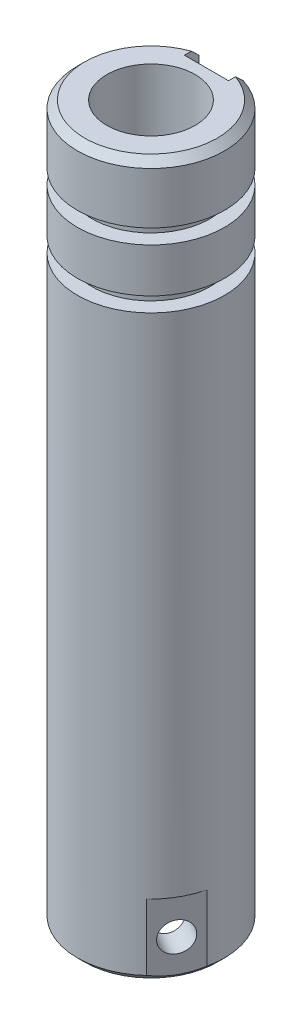
from build123d import *

# Parameters (mm, degrees)
ESQUISSE1_R                  = 5
ESQUISSE1_R_2                = 3
BOSS_EXTRU_1_DEPTH           = 48.5
ENL_V_MAT_EXTRU_1_DEPTH      = 5
ENL_V_MAT_EXTRU_2_REACH      = 51.901
ENL_V_MAT_EXTRU_2_END_RADIUS = 3
ESQUISSE3_R                  = 1
ESQUISSE4_R                  = 5
ESQUISSE4_R_2                = 4
ENL_V_MAT_EXTRU_3_DEPTH      = 1
ESQUISSE6_R                  = 5
ESQUISSE6_R_2                = 4
ENL_V_MAT_EXTRU_5_DEPTH      = 1
ENL_V_MAT_EXTRU_4_REACH      = 51.013


with BuildPart() as part:
    # Esquisse1 → Boss.-Extru.1 (new body)
    with BuildSketch(Plane(origin=(0, 0, 0), x_dir=(1, 0, 0), z_dir=(0, 1, 0))):
        with Locations(Location((0, 0, 0), (0, 0, 90))):
            Circle(ESQUISSE1_R)
        with Locations(Location((0, 0, 0), (0, 0, 90))):
            Circle(ESQUISSE1_R_2, mode=Mode.SUBTRACT)
    extrude(amount=BOSS_EXTRU_1_DEPTH)

    # Esquisse2 → Enlèv. mat.-Extru.1 (cut)
    with BuildSketch(Plane.XZ):
        with BuildLine():
            Line((-1.5, -4.769696007), (1.5, -4.769696007))
            ThreePointArc((1.5, -4.769696007), (0, -5), (-1.5, -4.769696007))
        make_face()
        with BuildLine():
            Line((-3.38067791, 3.683886109), (-4.88067791, 1.085809898))
            ThreePointArc((-4.88067791, 1.085809898), (-4.330127019, 2.5), (-3.38067791, 3.683886109))
        make_face()
        with BuildLine():
            Line((4.88067791, 1.085809898), (3.38067791, 3.683886109))
            ThreePointArc((3.38067791, 3.683886109), (4.330127019, 2.5), (4.88067791, 1.085809898))
        make_face()
    extrude(amount=-ENL_V_MAT_EXTRU_1_DEPTH, mode=Mode.SUBTRACT)

    # Enlèv. mat.-Extru.2: up to this cylinder (the profile starts outside it)
    enl_v_mat_extru_2_end = Plane(origin=(0, 2.5, 0), z_dir=(0, -1, 0)) * Cylinder(ENL_V_MAT_EXTRU_2_END_RADIUS, 110.802, mode=Mode.PRIVATE)
    # Esquisse3 → Enlèv. mat.-Extru.2 (cut, up to the surface)
    with BuildSketch(Plane(origin=(4.13067791, 0, 2.384848004), x_dir=(0.49999999999999223, 0, -0.8660254037844431), z_dir=(0.8660254037844431, 0, 0.49999999999999223)), mode=Mode.PRIVATE) as enl_v_mat_extru_2_sk1:
        with Locations((0, 2.5)):
            Circle(ESQUISSE3_R)
    enl_v_mat_extru_2_tool1 = extrude(enl_v_mat_extru_2_sk1.sketch, amount=-ENL_V_MAT_EXTRU_2_REACH, mode=Mode.PRIVATE) - enl_v_mat_extru_2_end
    add(enl_v_mat_extru_2_tool1.solids().sort_by_distance((4.130678, 2.5, 2.384848))[0], mode=Mode.SUBTRACT)

    # Esquisse4 → Enlèv. mat.-Extru.3 (cut)
    with BuildSketch(Plane(origin=(0, 39.5, 0), x_dir=(-1, 0, 0), z_dir=(0, -1, 0))):
        with Locations(Location((0, 0, 0), (0, 0, 90))):
            Circle(ESQUISSE4_R)
        with Locations(Location((0, 0, 0), (0, 0, 90))):
            Circle(ESQUISSE4_R_2, mode=Mode.SUBTRACT)
    extrude(amount=-ENL_V_MAT_EXTRU_3_DEPTH, mode=Mode.SUBTRACT)

    # Esquisse6 → Enlèv. mat.-Extru.5 (cut)
    with BuildSketch(Plane(origin=(0, 43.5, 0), x_dir=(-1, 0, 0), z_dir=(0, -1, 0))):
        with Locations(Location((0, 0, 0), (0, 0, 90))):
            Circle(ESQUISSE6_R)
        with Locations(Location((0, 0, 0), (0, 0, 90))):
            Circle(ESQUISSE6_R_2, mode=Mode.SUBTRACT)
    extrude(amount=-ENL_V_MAT_EXTRU_5_DEPTH, mode=Mode.SUBTRACT)

    # Enlèv. mat.-Extru.4: up to this face of the body (flat: up to its plane)
    enl_v_mat_extru_4_end = Plane(part.part.faces().sort_by_distance((0, 39.5, 4.858578644))[0])
    # Esquisse5 → Enlèv. mat.-Extru.4 (cut, up to the picked face)
    with BuildSketch(Plane(origin=(0, 48.5, 0), x_dir=(1, 0, 0), z_dir=(0, 1, 0)), mode=Mode.PRIVATE) as enl_v_mat_extru_4_sk1:
        with BuildLine():
            Line((-1.5, 3.769696007), (1.5, 3.769696007))
            Line((1.5, 3.769696007), (1.5, 4.769696007))
            ThreePointArc((1.5, 4.769696007), (0, 5), (-1.5, 4.769696007))
            Line((-1.5, 4.769696007), (-1.5, 3.769696007))
        make_face()
    enl_v_mat_extru_4_tool1 = split(extrude(enl_v_mat_extru_4_sk1.sketch, amount=-ENL_V_MAT_EXTRU_4_REACH, mode=Mode.PRIVATE), bisect_by=enl_v_mat_extru_4_end, keep=Keep.BOTH, mode=Mode.PRIVATE)
    add(enl_v_mat_extru_4_tool1.solids().sort_by(Axis((0, 48.5, -4.348853), (0, -1, 0)))[0], mode=Mode.SUBTRACT)

    # Chanfrein1: read off the stored shape, not the designer's step
    # Chanfrein1 outline → Chanfrein1 (revolve, cut)
    with BuildSketch(Plane.XY):
        Polygon((5, 0.5), (4.5, 0), (5, 0), align=None)
        Polygon((4.5, 48.5), (5, 48), (5, 48.5), align=None)
    revolve(axis=Axis((0, 0, 0), (0, 1, 0)), mode=Mode.SUBTRACT)


solid = part.part
